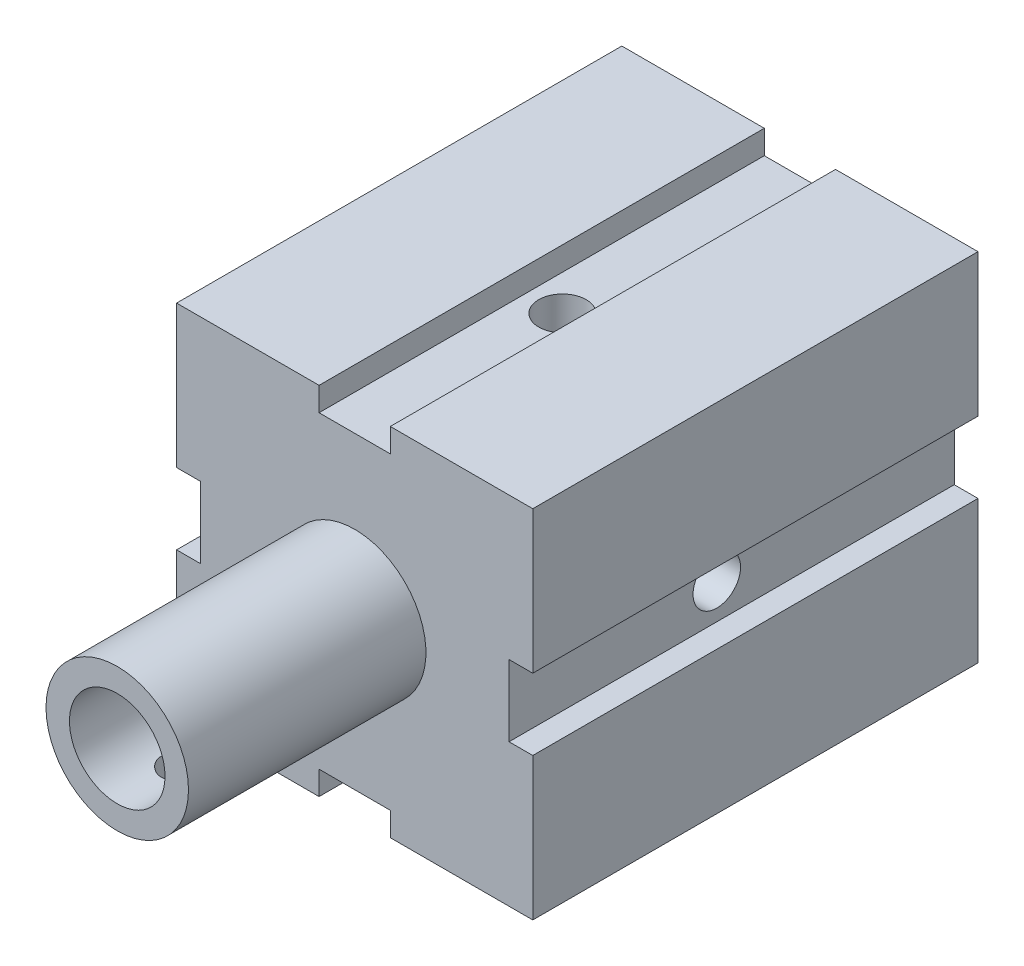
from build123d import *

# Parameters (mm, degrees)
SKETCH1_W                           = 30
SKETCH1_H                           = 30
BOSS_EXTRUDE1_DEPTH                 = 37.5
SKETCH2_R                           = 6
SKETCH2_R_2                         = 4.025
BOSS_EXTRUDE2_DEPTH                 = 20
CUT_EXTRUDE1_START                  = -10
SKETCH3_R                           = 4.025
CUT_EXTRUDE1_DEPTH                  = 10
SKETCH4_W                           = 6
SKETCH4_H                           = 75
CUT_EXTRUDE2_DEPTH                  = 2
CIRPATTERN1_COUNT                   = 4
SKETCH5_R                           = 2
CUT_EXTRUDE3_DEPTH                  = 126.128763374
SKETCH6_R                           = 2
CUT_EXTRUDE4_DEPTH                  = 339.953272019
M3X0_5_TAPPED_HOLE1_REACH           = 52.721
M3X0_5_TAPPED_HOLE1_BORE_R          = 1.25
M3X0_5_TAPPED_HOLE1_ON_FACE_2_REACH = 60.509
M3X0_5_TAPPED_HOLE1_BORE_2_R        = 1.25


with BuildPart() as part:
    # Sketch1 → Boss-Extrude1 (new body)
    with BuildSketch(Plane.XY):
        with Locations((317.864943501, 92.549790439)):
            Rectangle(SKETCH1_W, SKETCH1_H)
    extrude(amount=BOSS_EXTRUDE1_DEPTH)

    # Sketch2 → Boss-Extrude2 (add)
    with BuildSketch(Plane.XY.offset(37.5)):
        with Locations((317.864943501, 92.549790439)):
            Circle(SKETCH2_R)
        with Locations((317.864943501, 92.549790439)):
            Circle(SKETCH2_R_2, mode=Mode.SUBTRACT)
    extrude(amount=BOSS_EXTRUDE2_DEPTH)

    # Sketch3 → Cut-Extrude1 (cut)
    with BuildSketch(Plane.XY.offset(37.5).offset(CUT_EXTRUDE1_START)):
        with Locations((317.864943501, 92.549790439)):
            Circle(SKETCH3_R)
    extrude(amount=CUT_EXTRUDE1_DEPTH, mode=Mode.SUBTRACT)

    # Sketch4 → Cut-Extrude2 (cut)
    with BuildSketch(Plane.XZ.offset(-77.549790439)):
        with Locations((317.864943501, 0)):
            Rectangle(SKETCH4_W, SKETCH4_H)
    cut_extrude2 = extrude(amount=-CUT_EXTRUDE2_DEPTH, mode=Mode.SUBTRACT)

    # CirPattern1: Cut-Extrude2 ×4 about axis
    cirpattern1_axis = Axis((317.864943501, 92.549790439, 27.5), (0, 0, 1))
    for i in range(1, CIRPATTERN1_COUNT):
        add(cut_extrude2.rotate(cirpattern1_axis, i * 360 / CIRPATTERN1_COUNT), mode=Mode.SUBTRACT)

    # Sketch5 → Cut-Extrude3 (cut, through all)
    with BuildSketch(Plane(origin=(330.864943501, 0, 0), x_dir=(0, 0, -1), z_dir=(1, 0, 0))):
        with Locations((-20, 92.549790439)):
            Circle(SKETCH5_R)
    extrude(amount=-CUT_EXTRUDE3_DEPTH, mode=Mode.SUBTRACT)

    # Sketch6 → Cut-Extrude4 (cut, through all)
    with BuildSketch(Plane.XZ.offset(-79.549790439)):
        with Locations((317.864943501, 20)):
            Circle(SKETCH6_R)
    extrude(amount=-CUT_EXTRUDE4_DEPTH, mode=Mode.SUBTRACT)

    # M3x0.5 Tapped Hole1 bore (on position points) → M3x0.5 Tapped Hole1 (cut, up to next)
    with BuildSketch(Plane(origin=(317.711998096, 86.551740114, 43.612753669), x_dir=(-0.99967505419, 0.025490900946, 0), z_dir=(-0.025490900946, -0.99967505419, 0)), mode=Mode.PRIVATE) as m3x0_5_tapped_hole1_sk1:
        Circle(M3X0_5_TAPPED_HOLE1_BORE_R)
    m3x0_5_tapped_hole1_tool1 = extrude(m3x0_5_tapped_hole1_sk1.sketch, amount=-M3X0_5_TAPPED_HOLE1_REACH, mode=Mode.PRIVATE) & part.part
    add(m3x0_5_tapped_hole1_tool1.solids().sort_by_distance((317.711998, 86.55174, 43.612754))[0], mode=Mode.SUBTRACT)

    # M3x0.5 Tapped Hole1 bore 2 (on position points) → M3x0.5 Tapped Hole1 on face 2 (cut, up to next)
    with BuildSketch(Plane(origin=(317.668420808, 86.553009734, 52.454806576), x_dir=(-0.99946344332, 0.032754014528, 0), z_dir=(-0.032754014528, -0.99946344332, 0)), mode=Mode.PRIVATE) as m3x0_5_tapped_hole1_on_face_2_sk1:
        Circle(M3X0_5_TAPPED_HOLE1_BORE_2_R)
    m3x0_5_tapped_hole1_on_face_2_tool1 = extrude(m3x0_5_tapped_hole1_on_face_2_sk1.sketch, amount=-M3X0_5_TAPPED_HOLE1_ON_FACE_2_REACH, mode=Mode.PRIVATE) & part.part
    add(m3x0_5_tapped_hole1_on_face_2_tool1.solids().sort_by_distance((317.668421, 86.55301, 52.454807))[0], mode=Mode.SUBTRACT)


solid = part.part
